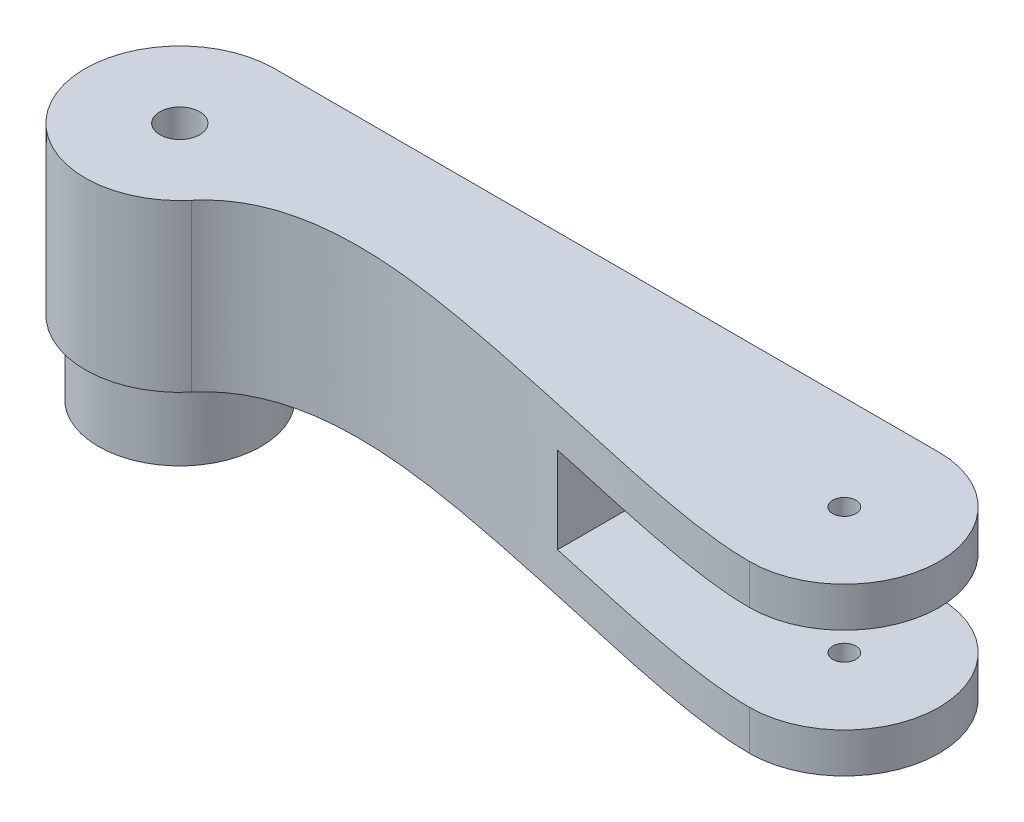
from build123d import *

# Parameters (mm, degrees)
BOSS_EXTRUDE1_DEPTH     = 6
SKETCH3_R               = 1.75
CUT_EXTRUDE2_DEPTH      = 67.08422656
BOSS_EXTRUDE2_DEPTH     = 13
BOSS_EXTRUDE3_DEPTH     = 6
CUT_EXTRUDE3_REACH      = 72.4
SKETCH6_R               = 1.75
CUT_EXTRUDE4_REACH      = 72.4
SKETCH8_R               = 12.25
BOSS_EXTRUDE4_DEPTH     = 11
SKETCH9_R               = 2.55
CUT_EXTRUDE5_DEPTH      = 6
CUT_EXTRUDE6_DEPTH      = 76.014165482
CUT_EXTRUDE6_DEPTH_BACK = 76.014165482
SKETCH11_R              = 3


with BuildPart() as part:
    # Sketch1 → Boss-Extrude1 (new body)
    with BuildSketch(Plane(origin=(0, 0, 0), x_dir=(1, 0, 0), z_dir=(0, 1, 0))):
        with BuildLine():
            Line((-50, 14.25), (50, 14.25))
            ThreePointArc((50, 14.25), (64.25, 0), (50, -14.25))
            Line((50, -14.25), (-50, -14.25))
            ThreePointArc((-50, -14.25), (-64.25, 0), (-50, 14.25))
        make_face()
    extrude(amount=BOSS_EXTRUDE1_DEPTH)

    # Sketch3 → Cut-Extrude2 (cut, through all)
    with BuildSketch(Plane.XZ):
        with Locations((50, 0)):
            Circle(SKETCH3_R)
    extrude(amount=-CUT_EXTRUDE2_DEPTH, mode=Mode.SUBTRACT)

    # Sketch4 → Boss-Extrude2 (add)
    with BuildSketch(Plane(origin=(0, 6, 0), x_dir=(1, 0, 0), z_dir=(0, 1, 0))):
        with BuildLine():
            Line((-50, 14.25), (15, 14.25))
            Line((15, 14.25), (15, -14.25))
            Line((15, -14.25), (-50, -14.25))
            ThreePointArc((-50, -14.25), (-64.25, 0), (-50, 14.25))
        make_face()
    extrude(amount=BOSS_EXTRUDE2_DEPTH)

    # Sketch5 → Boss-Extrude3 (add)
    with BuildSketch(Plane(origin=(0, 19, 0), x_dir=(1, 0, 0), z_dir=(0, 1, 0))):
        with BuildLine():
            Line((-50, 14.25), (50, 14.25))
            ThreePointArc((50, 14.25), (64.25, 0), (50, -14.25))
            Line((50, -14.25), (-50, -14.25))
            ThreePointArc((-50, -14.25), (-64.25, 0), (-50, 14.25))
        make_face()
    extrude(amount=BOSS_EXTRUDE3_DEPTH)

    # Sketch6 → Cut-Extrude3 (cut, up to next)
    with BuildSketch(Plane(origin=(0, 25, 0), x_dir=(1, 0, 0), z_dir=(0, 1, 0)), mode=Mode.PRIVATE) as cut_extrude3_sk1:
        with Locations((50, 0)):
            Circle(SKETCH6_R)
    cut_extrude3_tool1 = extrude(cut_extrude3_sk1.sketch, amount=-CUT_EXTRUDE3_REACH, mode=Mode.PRIVATE) & part.part
    add(cut_extrude3_tool1.solids().sort_by_distance((50, 25, 0))[0], mode=Mode.SUBTRACT)

    # Sketch7 → Cut-Extrude4 (cut, up to next)
    with BuildSketch(Plane(origin=(0, 25, 0), x_dir=(1, 0, 0), z_dir=(0, 1, 0)), mode=Mode.PRIVATE) as cut_extrude4_sk1:
        with BuildLine():
            ThreePointArc((-39.07315683, -9.146944754), (-43.970135273, -12.911360555), (-50, -14.25))
            Line((-50, -14.25), (50, -14.25))
            add(Edge.make_bspline(
                [(-39.07315683, -9.146944754), (-31.514094033, -0.116968526), (5.438655837, -4.645240543), (38.697514387, -14.25), (50, -14.25)],
                knots=[0, 0, 0, 0, 0.435907903, 1, 1, 1, 1], degree=3))
        make_face()
    cut_extrude4_tool1 = extrude(cut_extrude4_sk1.sketch, amount=-CUT_EXTRUDE4_REACH, mode=Mode.PRIVATE) & part.part
    add(cut_extrude4_tool1.solids().sort_by_distance((-8.590717, 25, 9.791359))[0], mode=Mode.SUBTRACT)

    # Sketch8 → Boss-Extrude4 (add)
    with BuildSketch(Plane.XZ):
        with Locations((-50, 0)):
            Circle(SKETCH8_R)
    extrude(amount=BOSS_EXTRUDE4_DEPTH)

    # Sketch9 → Cut-Extrude5 (cut)
    with BuildSketch(Plane.XZ.offset(11)):
        with Locations((-50, 6.75)):
            Circle(SKETCH9_R)
        with Locations((-50, -6.75)):
            Circle(SKETCH9_R)
    extrude(amount=-CUT_EXTRUDE5_DEPTH, mode=Mode.SUBTRACT)

    # Sketch11 → Cut-Extrude6 (cut, two sides: drawn at the far end of the back side and taken through both)
    with BuildSketch(Plane.XZ.offset(11).offset(-CUT_EXTRUDE6_DEPTH_BACK)):
        with Locations((-50, 0)):
            Circle(SKETCH11_R)
    extrude(amount=CUT_EXTRUDE6_DEPTH + CUT_EXTRUDE6_DEPTH_BACK, mode=Mode.SUBTRACT)


solid = part.part
